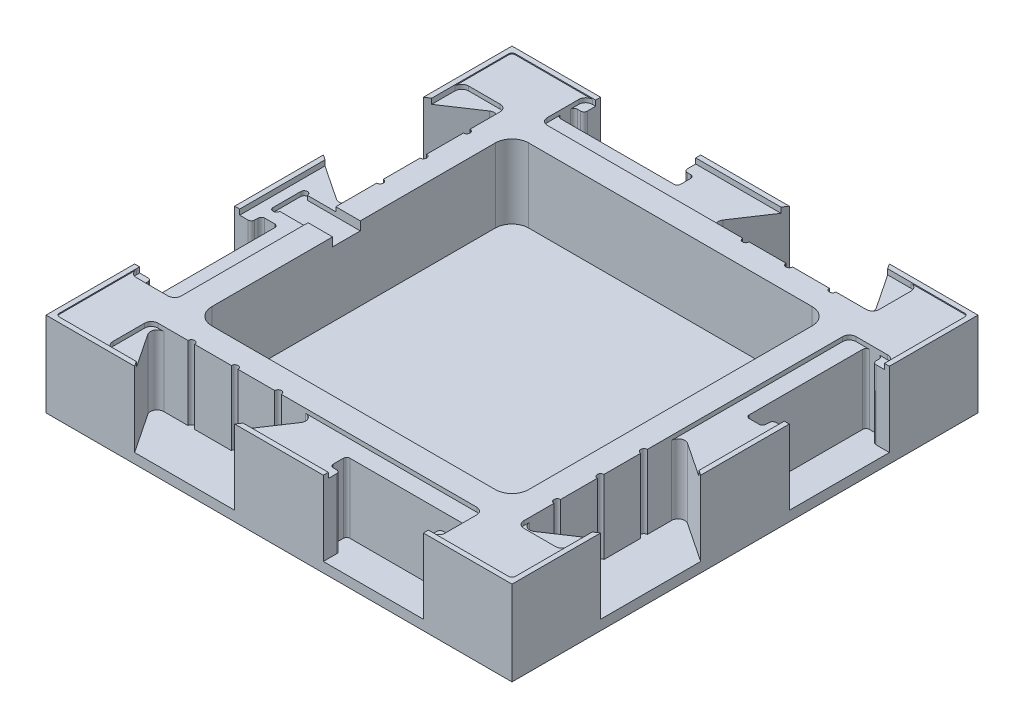
from build123d import *

# Parameters (mm, degrees)
SKETCH1_W               = 139.7
SKETCH1_H               = 139.7
BOSS_EXTRUDE1_DEPTH     = 12.7
SKETCH2_W               = 136.7
SKETCH2_H               = 136.7
CUT_EXTRUDE1_DEPTH      = 0.3
CUT_EXTRUDE2_START      = -22.4
CUT_EXTRUDE2_DEPTH      = 125.396102867
CUT_EXTRUDE4_DEPTH      = 22.1
SKETCH9_W               = 99.566666666
SKETCH9_H               = 13.5
CUT_EXTRUDE5_DEPTH      = 1.3
FILLET1_R               = 1
FILLET3_R               = 2
FILLET4_R               = 2
CIRPATTERN1_START       = -9.7
CIRPATTERN1_DEPTH       = 22.4
CIRPATTERN1_START_2     = 11.1
CIRPATTERN1_2_DEPTH     = 1.3
SKETCH11_W              = 95
SKETCH11_H              = 95
CUT_EXTRUDE6_DEPTH      = 22.1
FILLET6_R               = 5
CUT_EXTRUDE7_DEPTH      = 102.609472984
CUT_EXTRUDE7_DEPTH_BACK = 1.3


# Read off the part's stored shape, not the designer's step: CirPattern1
with BuildPart() as part:
    # Sketch1 → Boss-Extrude1 (new, symmetric)
    with BuildSketch(Plane(origin=(0, 0, 0), x_dir=(1, 0, 0), z_dir=(0, 1, 0))):
        Rectangle(SKETCH1_W, SKETCH1_H)
    extrude(amount=BOSS_EXTRUDE1_DEPTH, both=True)

    # Sketch2 → Cut-Extrude1 (cut)
    with BuildSketch(Plane(origin=(0, 12.7, 0), x_dir=(1, 0, 0), z_dir=(0, 1, 0))):
        Rectangle(SKETCH2_W, SKETCH2_H)
    extrude(amount=-CUT_EXTRUDE1_DEPTH, mode=Mode.SUBTRACT)

    # Sketch4 → Cut-Extrude2 (cut)
    with BuildSketch(Plane(origin=(0, 12.7, 0), x_dir=(1, 0, 0), z_dir=(0, 1, 0)).offset(CUT_EXTRUDE2_START)):
        Polygon((-43.283333333, -69.85), (-53.283333333, -54.85), (-3.283333333, -54.85), (-13.283333333, -69.85), align=None)
        Polygon((13.283333333, -69.85), (13.283333333, -64.85), (10.283333333, -64.85), (10.283333333, -59.85), (46.283333333, -59.85), (46.283333333, -64.85), (43.283333333, -64.85), (43.283333333, -69.85), align=None)
    extrude(amount=CUT_EXTRUDE2_DEPTH, mode=Mode.SUBTRACT)

    # Sketch6 → Cut-Extrude4 (cut)
    with BuildSketch(Plane(origin=(0, 12.4, 0), x_dir=(1, 0, 0), z_dir=(0, 1, 0))):
        with BuildLine():
            Line((-42.283333333, -54.85), (-40.283333333, -54.85))
            ThreePointArc((-40.283333333, -54.85), (-41.283333333, -53.85), (-42.283333333, -54.85))
        make_face()
        with BuildLine():
            Line((-29.283333333, -54.85), (-27.283333333, -54.85))
            ThreePointArc((-27.283333333, -54.85), (-28.283333333, -53.85), (-29.283333333, -54.85))
        make_face()
        with BuildLine():
            Line((-16.283333333, -54.85), (-14.283333333, -54.85))
            ThreePointArc((-14.283333333, -54.85), (-15.283333333, -53.85), (-16.283333333, -54.85))
        make_face()
    extrude(amount=-CUT_EXTRUDE4_DEPTH, mode=Mode.SUBTRACT)

    # Sketch9 → Cut-Extrude5 (cut)
    with BuildSketch(Plane(origin=(0, 12.4, 0), x_dir=(1, 0, 0), z_dir=(0, 1, 0))):
        with Locations((-3.5, -61.6)):
            Rectangle(SKETCH9_W, SKETCH9_H)
    extrude(amount=-CUT_EXTRUDE5_DEPTH, mode=Mode.SUBTRACT)

    # Fillet1
    fillet1_edges = [part.edges().sort_by_distance(p)[0] for p in [
        (-68.35, 12.55, -68.35),
        (-68.35, 12.55, 68.35),
        (68.35, 12.55, 68.35),
        (68.35, 12.55, -68.35),
        (46.283333333, 0.7, 64.85),
        (46.283333333, 0.7, 59.85),
        (10.283333333, 0.7, 59.85),
        (10.283333333, 0.7, 64.85),
        (13.283333333, 0.7, 64.85),
        (43.283333333, 0.7, 64.85),
    ]]
    fillet(fillet1_edges, radius=FILLET1_R)

    # Fillet3
    fillet3_edges = [part.edges().sort_by_distance(p)[0] for p in [
        (-53.283333333, 0.7, 54.85),
        (-3.283333333, 0.7, 54.85),
    ]]
    fillet(fillet3_edges, radius=FILLET3_R)

    # Fillet4
    fillet4_edges = [part.edges().sort_by_distance(p)[0] for p in [
        (46.283333333, 11.75, 54.85),
        (46.283333333, 11.75, 68.35),
        (-53.283333333, 11.75, 54.85),
        (-53.283333333, 11.75, 68.35),
    ]]
    fillet(fillet4_edges, radius=FILLET4_R)

    # CirPattern1 outline → CirPattern1 (cut)
    with BuildSketch(Plane(origin=(0, 0, 0), x_dir=(1, 0, 0), z_dir=(0, 1, 0)).offset(CIRPATTERN1_START)):
        with BuildLine():
            ThreePointArc((54.85, -14.283333333), (53.85, -15.283333333), (54.85, -16.283333333))
            Line((54.85, -16.283333333), (54.85, -27.283333333))
            ThreePointArc((54.85, -27.283333333), (53.85, -28.283333333), (54.85, -29.283333333))
            Line((54.85, -29.283333333), (54.85, -40.283333333))
            ThreePointArc((54.85, -40.283333333), (53.85, -41.283333333), (54.85, -42.283333333))
            Line((54.85, -42.283333333), (54.85, -49.54629915))
            ThreePointArc((54.85, -49.54629915), (55.906284149, -51.309648347), (57.959400392, -51.210399738))
            Line((57.959400392, -51.210399738), (69.85, -43.283333333))
            Line((69.85, -43.283333333), (69.85, -13.283333333))
            Line((69.85, -13.283333333), (57.959400392, -5.356266928))
            ThreePointArc((57.959400392, -5.356266928), (55.906284149, -5.257018319), (54.85, -7.020367517))
            Line((54.85, -7.020367517), (54.85, -14.283333333))
        make_face()
        with BuildLine():
            Line((-69.85, 43.283333333), (-69.85, 13.283333333))
            Line((-69.85, 13.283333333), (-57.959400392, 5.356266928))
            ThreePointArc((-57.959400392, 5.356266928), (-55.906284149, 5.257018319), (-54.85, 7.020367517))
            Line((-54.85, 7.020367517), (-54.85, 14.283333333))
            ThreePointArc((-54.85, 14.283333333), (-53.85, 15.283333333), (-54.85, 16.283333333))
            Line((-54.85, 16.283333333), (-54.85, 27.283333333))
            ThreePointArc((-54.85, 27.283333333), (-53.85, 28.283333333), (-54.85, 29.283333333))
            Line((-54.85, 29.283333333), (-54.85, 40.283333333))
            ThreePointArc((-54.85, 40.283333333), (-53.85, 41.283333333), (-54.85, 42.283333333))
            Line((-54.85, 42.283333333), (-54.85, 49.54629915))
            ThreePointArc((-54.85, 49.54629915), (-55.906284149, 51.309648347), (-57.959400392, 51.210399738))
            Line((-57.959400392, 51.210399738), (-69.85, 43.283333333))
        make_face()
        with BuildLine():
            Line((43.283333333, 69.85), (13.283333333, 69.85))
            Line((13.283333333, 69.85), (5.356266928, 57.959400392))
            ThreePointArc((5.356266928, 57.959400392), (5.257018319, 55.906284149), (7.020367517, 54.85))
            Line((7.020367517, 54.85), (14.283333333, 54.85))
            ThreePointArc((14.283333333, 54.85), (15.283333333, 53.85), (16.283333333, 54.85))
            Line((16.283333333, 54.85), (27.283333333, 54.85))
            ThreePointArc((27.283333333, 54.85), (28.283333333, 53.85), (29.283333333, 54.85))
            Line((29.283333333, 54.85), (40.283333333, 54.85))
            ThreePointArc((40.283333333, 54.85), (41.283333333, 53.85), (42.283333333, 54.85))
            Line((42.283333333, 54.85), (49.54629915, 54.85))
            ThreePointArc((49.54629915, 54.85), (51.309648347, 55.906284149), (51.210399738, 57.959400392))
            Line((51.210399738, 57.959400392), (43.283333333, 69.85))
        make_face()
        with BuildLine():
            Line((63.85, 46.283333333), (60.85, 46.283333333))
            ThreePointArc((60.85, 46.283333333), (60.142893218, 45.990440115), (59.85, 45.283333333))
            Line((59.85, 45.283333333), (59.85, 11.283333333))
            ThreePointArc((59.85, 11.283333333), (60.142893219, 10.576226552), (60.85, 10.283333333))
            Line((60.85, 10.283333333), (63.85, 10.283333333))
            ThreePointArc((63.85, 10.283333333), (64.557106781, 10.576226552), (64.85, 11.283333333))
            Line((64.85, 11.283333333), (64.85, 12.283333333))
            ThreePointArc((64.85, 12.283333333), (65.142893218, 12.990440114), (65.85, 13.283333333))
            Line((65.85, 13.283333333), (69.85, 13.283333333))
            Line((69.85, 13.283333333), (69.85, 43.283333333))
            Line((69.85, 43.283333333), (65.85, 43.283333333))
            ThreePointArc((65.85, 43.283333333), (65.142893219, 43.576226552), (64.85, 44.283333333))
            Line((64.85, 44.283333333), (64.85, 45.283333333))
            ThreePointArc((64.85, 45.283333333), (64.557106781, 45.990440115), (63.85, 46.283333333))
        make_face()
        with BuildLine():
            Line((-13.283333333, 69.85), (-43.283333333, 69.85))
            Line((-43.283333333, 69.85), (-43.283333333, 65.85))
            ThreePointArc((-43.283333333, 65.85), (-43.576226552, 65.142893219), (-44.283333333, 64.85))
            Line((-44.283333333, 64.85), (-45.283333333, 64.85))
            ThreePointArc((-45.283333333, 64.85), (-45.990440115, 64.557106781), (-46.283333333, 63.85))
            Line((-46.283333333, 63.85), (-46.283333333, 60.85))
            ThreePointArc((-46.283333333, 60.85), (-45.990440115, 60.142893218), (-45.283333333, 59.85))
            Line((-45.283333333, 59.85), (-11.283333333, 59.85))
            ThreePointArc((-11.283333333, 59.85), (-10.576226552, 60.142893219), (-10.283333333, 60.85))
            Line((-10.283333333, 60.85), (-10.283333333, 63.85))
            ThreePointArc((-10.283333333, 63.85), (-10.576226552, 64.557106781), (-11.283333333, 64.85))
            Line((-11.283333333, 64.85), (-12.283333333, 64.85))
            ThreePointArc((-12.283333333, 64.85), (-12.990440114, 65.142893218), (-13.283333333, 65.85))
            Line((-13.283333333, 65.85), (-13.283333333, 69.85))
        make_face()
        with BuildLine():
            Line((-69.85, -13.283333333), (-69.85, -43.283333333))
            Line((-69.85, -43.283333333), (-65.85, -43.283333333))
            ThreePointArc((-65.85, -43.283333333), (-65.142893219, -43.576226552), (-64.85, -44.283333333))
            Line((-64.85, -44.283333333), (-64.85, -45.283333333))
            ThreePointArc((-64.85, -45.283333333), (-64.557106781, -45.990440115), (-63.85, -46.283333333))
            Line((-63.85, -46.283333333), (-60.85, -46.283333333))
            ThreePointArc((-60.85, -46.283333333), (-60.142893218, -45.990440115), (-59.85, -45.283333333))
            Line((-59.85, -45.283333333), (-59.85, -11.283333333))
            ThreePointArc((-59.85, -11.283333333), (-60.142893219, -10.576226552), (-60.85, -10.283333333))
            Line((-60.85, -10.283333333), (-63.85, -10.283333333))
            ThreePointArc((-63.85, -10.283333333), (-64.557106781, -10.576226552), (-64.85, -11.283333333))
            Line((-64.85, -11.283333333), (-64.85, -12.283333333))
            ThreePointArc((-64.85, -12.283333333), (-65.142893218, -12.990440114), (-65.85, -13.283333333))
            Line((-65.85, -13.283333333), (-69.85, -13.283333333))
        make_face()
    extrude(amount=CIRPATTERN1_DEPTH, mode=Mode.SUBTRACT)

    # CirPattern1 2 outline → CirPattern1 2 (cut)
    with BuildSketch(Plane(origin=(0, 0, 0), x_dir=(1, 0, 0), z_dir=(0, 1, 0)).offset(CIRPATTERN1_START_2)):
        with BuildLine():
            Line((54.85, 44.283333333), (54.85, -7.020367517))
            ThreePointArc((54.85, -7.020367517), (55.906284149, -5.257018319), (57.959400392, -5.356266928))
            Line((57.959400392, -5.356266928), (68.35, -12.283333333))
            Line((68.35, -12.283333333), (68.35, 13.283333333))
            Line((68.35, 13.283333333), (65.85, 13.283333333))
            ThreePointArc((65.85, 13.283333333), (65.142893218, 12.990440114), (64.85, 12.283333333))
            Line((64.85, 12.283333333), (64.85, 11.283333333))
            ThreePointArc((64.85, 11.283333333), (64.557106781, 10.576226552), (63.85, 10.283333333))
            Line((63.85, 10.283333333), (60.85, 10.283333333))
            ThreePointArc((60.85, 10.283333333), (60.142893219, 10.576226552), (59.85, 11.283333333))
            Line((59.85, 11.283333333), (59.85, 45.283333333))
            ThreePointArc((59.85, 45.283333333), (60.142893218, 45.990440115), (60.85, 46.283333333))
            Line((60.85, 46.283333333), (56.85, 46.283333333))
            ThreePointArc((56.85, 46.283333333), (55.435786438, 45.697546896), (54.85, 44.283333333))
        make_face()
        with BuildLine():
            ThreePointArc((57.959400392, -51.210399738), (55.906284149, -51.309648347), (54.85, -49.54629915))
            Line((54.85, -49.54629915), (54.85, -51.283333333))
            ThreePointArc((54.85, -51.283333333), (55.435786438, -52.697546896), (56.85, -53.283333333))
            Line((56.85, -53.283333333), (66.35, -53.283333333))
            ThreePointArc((66.35, -53.283333333), (67.764213562, -52.697546896), (68.35, -51.283333333))
            Line((68.35, -51.283333333), (68.35, -44.283333333))
            Line((68.35, -44.283333333), (57.959400392, -51.210399738))
        make_face()
        with BuildLine():
            Line((66.35, 46.283333333), (63.85, 46.283333333))
            ThreePointArc((63.85, 46.283333333), (64.557106781, 45.990440115), (64.85, 45.283333333))
            Line((64.85, 45.283333333), (64.85, 44.283333333))
            ThreePointArc((64.85, 44.283333333), (65.142893219, 43.576226552), (65.85, 43.283333333))
            Line((65.85, 43.283333333), (68.35, 43.283333333))
            Line((68.35, 43.283333333), (68.35, 44.283333333))
            ThreePointArc((68.35, 44.283333333), (67.764213562, 45.697546896), (66.35, 46.283333333))
        make_face()
        with BuildLine():
            Line((51.283333333, 68.35), (44.283333333, 68.35))
            Line((44.283333333, 68.35), (51.210399738, 57.959400392))
            ThreePointArc((51.210399738, 57.959400392), (51.309648347, 55.906284149), (49.54629915, 54.85))
            Line((49.54629915, 54.85), (51.283333333, 54.85))
            ThreePointArc((51.283333333, 54.85), (52.697546896, 55.435786438), (53.283333333, 56.85))
            Line((53.283333333, 56.85), (53.283333333, 66.35))
            ThreePointArc((53.283333333, 66.35), (52.697546896, 67.764213562), (51.283333333, 68.35))
        make_face()
        with BuildLine():
            Line((5.356266928, 57.959400392), (12.283333333, 68.35))
            Line((12.283333333, 68.35), (-13.283333333, 68.35))
            Line((-13.283333333, 68.35), (-13.283333333, 65.85))
            ThreePointArc((-13.283333333, 65.85), (-12.990440114, 65.142893218), (-12.283333333, 64.85))
            Line((-12.283333333, 64.85), (-11.283333333, 64.85))
            ThreePointArc((-11.283333333, 64.85), (-10.576226552, 64.557106781), (-10.283333333, 63.85))
            Line((-10.283333333, 63.85), (-10.283333333, 60.85))
            ThreePointArc((-10.283333333, 60.85), (-10.576226552, 60.142893219), (-11.283333333, 59.85))
            Line((-11.283333333, 59.85), (-45.283333333, 59.85))
            ThreePointArc((-45.283333333, 59.85), (-45.990440115, 60.142893218), (-46.283333333, 60.85))
            Line((-46.283333333, 60.85), (-46.283333333, 56.85))
            ThreePointArc((-46.283333333, 56.85), (-45.697546896, 55.435786438), (-44.283333333, 54.85))
            Line((-44.283333333, 54.85), (7.020367517, 54.85))
            ThreePointArc((7.020367517, 54.85), (5.257018319, 55.906284149), (5.356266928, 57.959400392))
        make_face()
        with BuildLine():
            Line((-43.283333333, 65.85), (-43.283333333, 68.35))
            Line((-43.283333333, 68.35), (-44.283333333, 68.35))
            ThreePointArc((-44.283333333, 68.35), (-45.697546896, 67.764213562), (-46.283333333, 66.35))
            Line((-46.283333333, 66.35), (-46.283333333, 63.85))
            ThreePointArc((-46.283333333, 63.85), (-45.990440115, 64.557106781), (-45.283333333, 64.85))
            Line((-45.283333333, 64.85), (-44.283333333, 64.85))
            ThreePointArc((-44.283333333, 64.85), (-43.576226552, 65.142893219), (-43.283333333, 65.85))
        make_face()
        with BuildLine():
            Line((-68.35, 51.283333333), (-68.35, 44.283333333))
            Line((-68.35, 44.283333333), (-57.959400392, 51.210399738))
            ThreePointArc((-57.959400392, 51.210399738), (-55.906284149, 51.309648347), (-54.85, 49.54629915))
            Line((-54.85, 49.54629915), (-54.85, 51.283333333))
            ThreePointArc((-54.85, 51.283333333), (-55.435786438, 52.697546896), (-56.85, 53.283333333))
            Line((-56.85, 53.283333333), (-66.35, 53.283333333))
            ThreePointArc((-66.35, 53.283333333), (-67.764213562, 52.697546896), (-68.35, 51.283333333))
        make_face()
        with BuildLine():
            Line((-57.959400392, 5.356266928), (-68.35, 12.283333333))
            Line((-68.35, 12.283333333), (-68.35, -13.283333333))
            Line((-68.35, -13.283333333), (-65.85, -13.283333333))
            ThreePointArc((-65.85, -13.283333333), (-65.142893218, -12.990440114), (-64.85, -12.283333333))
            Line((-64.85, -12.283333333), (-64.85, -11.283333333))
            ThreePointArc((-64.85, -11.283333333), (-64.557106781, -10.576226552), (-63.85, -10.283333333))
            Line((-63.85, -10.283333333), (-60.85, -10.283333333))
            ThreePointArc((-60.85, -10.283333333), (-60.142893219, -10.576226552), (-59.85, -11.283333333))
            Line((-59.85, -11.283333333), (-59.85, -45.283333333))
            ThreePointArc((-59.85, -45.283333333), (-60.142893218, -45.990440115), (-60.85, -46.283333333))
            Line((-60.85, -46.283333333), (-56.85, -46.283333333))
            ThreePointArc((-56.85, -46.283333333), (-55.435786438, -45.697546896), (-54.85, -44.283333333))
            Line((-54.85, -44.283333333), (-54.85, 7.020367517))
            ThreePointArc((-54.85, 7.020367517), (-55.906284149, 5.257018319), (-57.959400392, 5.356266928))
        make_face()
        with BuildLine():
            Line((-65.85, -43.283333333), (-68.35, -43.283333333))
            Line((-68.35, -43.283333333), (-68.35, -44.283333333))
            ThreePointArc((-68.35, -44.283333333), (-67.764213562, -45.697546896), (-66.35, -46.283333333))
            Line((-66.35, -46.283333333), (-63.85, -46.283333333))
            ThreePointArc((-63.85, -46.283333333), (-64.557106781, -45.990440115), (-64.85, -45.283333333))
            Line((-64.85, -45.283333333), (-64.85, -44.283333333))
            ThreePointArc((-64.85, -44.283333333), (-65.142893219, -43.576226552), (-65.85, -43.283333333))
        make_face()
    extrude(amount=CIRPATTERN1_2_DEPTH, mode=Mode.SUBTRACT)

    # Sketch11 → Cut-Extrude6 (cut)
    with BuildSketch(Plane(origin=(0, 12.4, 0), x_dir=(1, 0, 0), z_dir=(0, 1, 0))):
        Rectangle(SKETCH11_W, SKETCH11_H)
    extrude(amount=-CUT_EXTRUDE6_DEPTH, mode=Mode.SUBTRACT)

    # Fillet6
    fillet6_edges = [part.edges().sort_by_distance(p)[0] for p in [
        (47.5, 1.35, 47.5),
        (47.5, 1.35, -47.5),
        (-47.5, 1.35, -47.5),
        (-47.5, 1.35, 47.5),
    ]]
    fillet(fillet6_edges, radius=FILLET6_R)

    # Sketch12 → Cut-Extrude7 (cut, two sides: drawn at the far end of the back side and taken through both)
    with BuildSketch(Plane(origin=(0, 11.1, 0), x_dir=(1, 0, 0), z_dir=(0, 1, 0)).offset(-CUT_EXTRUDE7_DEPTH_BACK)):
        with BuildLine():
            Line((-65.35, 2.020367517), (-65.35, -6.283333333))
            ThreePointArc((-65.35, -6.283333333), (-64.35, -7.283333333), (-63.35, -6.283333333))
            Line((-63.35, -6.283333333), (-47.5, -6.283333333))
            Line((-47.5, -6.283333333), (-47.5, 2.020367517))
            Line((-47.5, 2.020367517), (-63.35, 2.020367517))
            ThreePointArc((-63.35, 2.020367517), (-64.35, 3.020367517), (-65.35, 2.020367517))
        make_face()
    extrude(amount=CUT_EXTRUDE7_DEPTH + CUT_EXTRUDE7_DEPTH_BACK, mode=Mode.SUBTRACT)


solid = part.part
